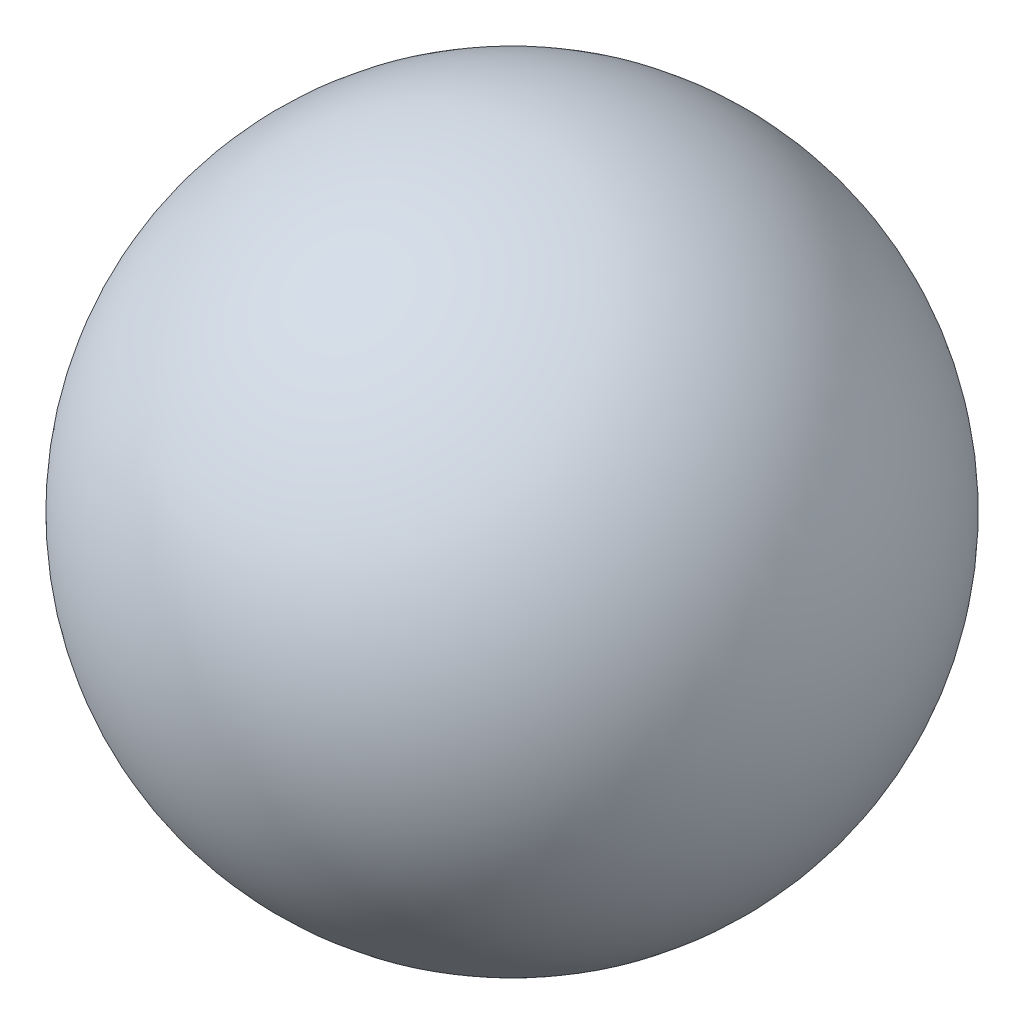
from build123d import *


with BuildPart() as part:
    # Sketch1 → Revolve1 (revolve)
    with BuildSketch(Plane.XY):
        with BuildLine():
            Line((0, 6), (0, -6))
            ThreePointArc((0, -6), (-6, 0), (0, 6))
        make_face()
    revolve(axis=Axis((0, 6, 0), (0, -1, 0)))


solid = part.part
